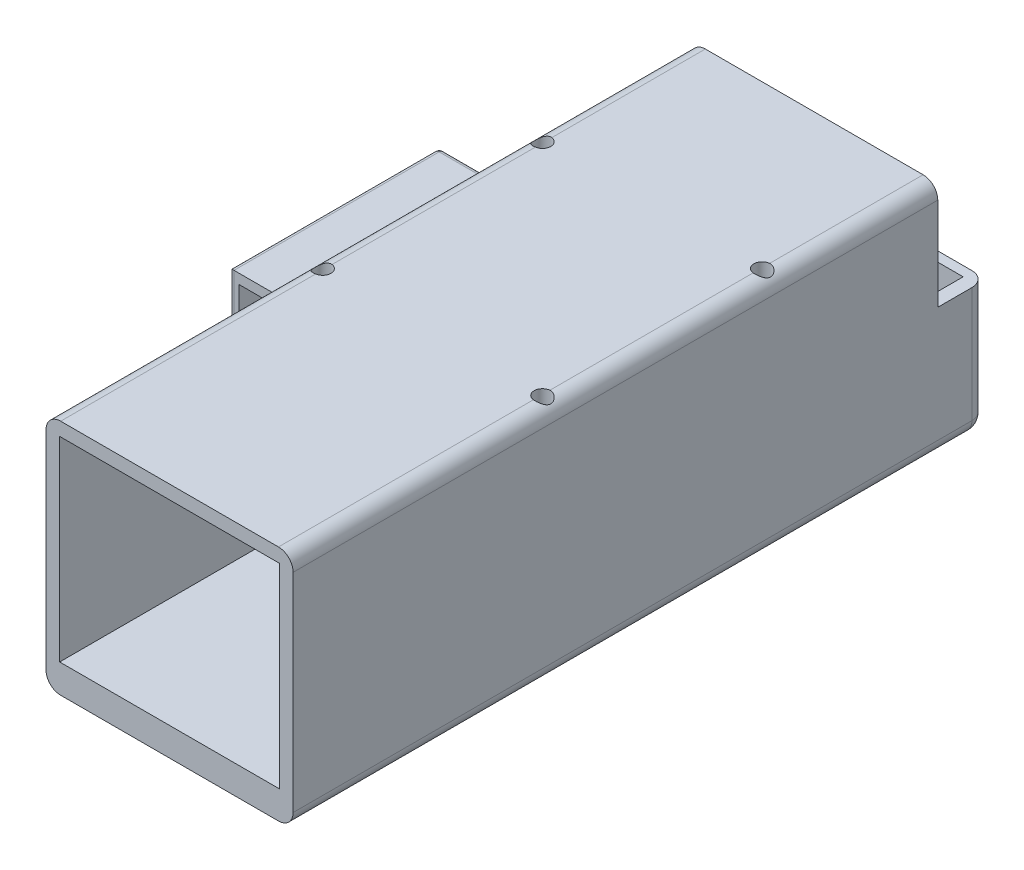
from build123d import *

# Parameters (mm, degrees)
SKETCH1_W           = 50.6
SKETCH1_H           = 45.6
SKETCH1_W_2         = 45
SKETCH1_H_2         = 40
BOSS_EXTRUDE1_DEPTH = 70
SKETCH2_W           = 50.6
SKETCH2_H           = 45.6
BOSS_EXTRUDE2_DEPTH = 2
SKETCH4_R           = 1.7
CUT_EXTRUDE1_DEPTH  = 71.5
SKETCH5_R           = 2.75
CUT_EXTRUDE2_DEPTH  = 12.5
SKETCH6_W           = 50.6
SKETCH6_H           = 4.293520681
BOSS_EXTRUDE3_DEPTH = 142
SKETCH7_R           = 1.7
CUT_EXTRUDE3_DEPTH  = 7.5
FILLET1_R           = 3
CUT_EXTRUDE4_DEPTH  = 22
BOSS_EXTRUDE4_DEPTH = 14.5
SKETCH10_W          = 43
SKETCH10_H          = 28.7
BOSS_EXTRUDE5_DEPTH = 2
SKETCH11_W          = 14
SKETCH11_H          = 24.7
CUT_EXTRUDE5_DEPTH  = 2
SKETCH12_W          = 6
SKETCH12_H          = 6
CUT_EXTRUDE6_DEPTH  = 2
FILLET2_R           = 1


with BuildPart() as part:
    # Sketch1 → Boss-Extrude1 (new, symmetric)
    with BuildSketch(Plane.XY):
        Rectangle(SKETCH1_W, SKETCH1_H)
        Rectangle(SKETCH1_W_2, SKETCH1_H_2, mode=Mode.SUBTRACT)
    extrude(amount=BOSS_EXTRUDE1_DEPTH, both=True)

    # Sketch2 → Boss-Extrude2 (add)
    with BuildSketch(Plane(origin=(0, 0, -70), x_dir=(-1, 0, 0), z_dir=(0, 0, -1))):
        Rectangle(SKETCH2_W, SKETCH2_H)
    extrude(amount=BOSS_EXTRUDE2_DEPTH)

    # Sketch4 → Cut-Extrude1 (cut)
    with BuildSketch(Plane(origin=(0, 22.8, 0), x_dir=(1, 0, 0), z_dir=(0, 1, 0))):
        with Locations(Location((-22.534370918, 28.890457594, 0), (0, 0, 270))):
            Circle(SKETCH4_R)
        with Locations(Location((22.465629082, 28.890457594, 0), (0, 0, 270))):
            Circle(SKETCH4_R)
        with Locations(Location((22.465629082, -16.109542406, 0), (0, 0, 270))):
            Circle(SKETCH4_R)
        with Locations(Location((-22.534370918, -16.109542406, 0), (0, 0, 270))):
            Circle(SKETCH4_R)
    extrude(amount=-CUT_EXTRUDE1_DEPTH, mode=Mode.SUBTRACT)

    # Sketch5 → Cut-Extrude2 (cut)
    with BuildSketch(Plane(origin=(0, -10, 0), x_dir=(1, 0, 0), z_dir=(0, 1, 0))):
        with Locations(Location((22.465629082, 28.890457594, 0), (0, 0, 270))):
            Circle(SKETCH5_R)
        with Locations(Location((22.465629082, -16.109542406, 0), (0, 0, 270))):
            Circle(SKETCH5_R)
        with Locations(Location((-22.534370918, 28.890457594, 0), (0, 0, 270))):
            Circle(SKETCH5_R)
        with Locations(Location((-22.534370918, -16.109542406, 0), (0, 0, 270))):
            Circle(SKETCH5_R)
    extrude(amount=-CUT_EXTRUDE2_DEPTH, mode=Mode.SUBTRACT)

    # Sketch6 → Boss-Extrude3 (add)
    with BuildSketch(Plane.XY.offset(70)):
        with Locations((0, -23.65323966)):
            Rectangle(SKETCH6_W, SKETCH6_H)
    extrude(amount=-BOSS_EXTRUDE3_DEPTH)

    # Sketch7 → Cut-Extrude3 (cut)
    with BuildSketch(Plane(origin=(0, -21.506479319, 0), x_dir=(1, 0, 0), z_dir=(0, 1, 0))):
        with Locations(Location((-22.534370918, 28.890457594, 0), (0, 0, 270))):
            Circle(SKETCH7_R)
        with Locations(Location((22.465629082, 28.890457594, 0), (0, 0, 270))):
            Circle(SKETCH7_R)
        with Locations(Location((22.465629082, -16.109542406, 0), (0, 0, 270))):
            Circle(SKETCH7_R)
        with Locations(Location((-22.534370918, -16.109542406, 0), (0, 0, 270))):
            Circle(SKETCH7_R)
    extrude(amount=-CUT_EXTRUDE3_DEPTH, mode=Mode.SUBTRACT)

    # Fillet1
    # the kernel refuses this fillet: 3 mm, written as the material it takes off along each edge
    with BuildSketch(Plane(origin=(-22.3, -22.8, -69), x_dir=(0, 0, -1), z_dir=(-1, 0, 0))) as fillet1_piece_1_section:
        Polygon((0, 0), (FILLET1_R, 0), (FILLET1_R, FILLET1_R), (0, FILLET1_R), align=None)
    fillet1_piece_1 = extrude(amount=FILLET1_R, mode=Mode.PRIVATE)
    fillet1_piece_1 = fillet1_piece_1 - Plane(origin=(-22.3, -22.8, -69), x_dir=(-2.085182079516792e-15, 0.7071067811865475, 0.7071067811865475), z_dir=(-1, 0, 0)) * Sphere(FILLET1_R, mode=Mode.PRIVATE)
    add(fillet1_piece_1, mode=Mode.SUBTRACT)
    with BuildSketch(Plane(origin=(22.3, -22.8, -69), x_dir=(0, -1, 0), z_dir=(0, 0, -1))) as fillet1_piece_2_section:
        Polygon((0, 0), (FILLET1_R, 0), (FILLET1_R, -FILLET1_R), (0, -FILLET1_R), align=None)
    fillet1_piece_2 = extrude(amount=FILLET1_R, mode=Mode.PRIVATE)
    fillet1_piece_2 = fillet1_piece_2 - Plane(origin=(22.3, -22.8, -69), x_dir=(-0.7071067811865486, 0.7071067811865464, 0), z_dir=(0, 0, -1)) * Sphere(FILLET1_R, mode=Mode.PRIVATE)
    add(fillet1_piece_2, mode=Mode.SUBTRACT)
    with BuildSketch(Plane(origin=(22.3, 19.8, -69), x_dir=(0, 0, -1), z_dir=(0, 1, 0))) as fillet1_piece_3_section:
        Polygon((0, 0), (FILLET1_R, 0), (FILLET1_R, -FILLET1_R), (0, -FILLET1_R), align=None)
    fillet1_piece_3 = extrude(amount=FILLET1_R, mode=Mode.PRIVATE)
    fillet1_piece_3 = fillet1_piece_3 - Plane(origin=(22.3, 19.8, -69), x_dir=(-0.7071067811865475, 0, 0.7071067811865475), z_dir=(0, 1, 0)) * Sphere(FILLET1_R, mode=Mode.PRIVATE)
    add(fillet1_piece_3, mode=Mode.SUBTRACT)
    with BuildSketch(Plane(origin=(-22.3, 19.8, -69), x_dir=(0, 1, 0), z_dir=(-1, 0, 0))) as fillet1_piece_4_section:
        Polygon((0, 0), (FILLET1_R, 0), (FILLET1_R, FILLET1_R), (0, FILLET1_R), align=None)
    fillet1_piece_4 = extrude(amount=FILLET1_R, mode=Mode.PRIVATE)
    fillet1_piece_4 = fillet1_piece_4 - Plane(origin=(-22.3, 19.8, -69), x_dir=(0, -0.7071067811865475, 0.7071067811865475), z_dir=(-1, 0, 0)) * Sphere(FILLET1_R, mode=Mode.PRIVATE)
    add(fillet1_piece_4, mode=Mode.SUBTRACT)
    with BuildSketch(Plane(origin=(-25.3, -25.8, 77.5), x_dir=(0, 1, 0), z_dir=(0, 0, -1)), Plane(origin=(25.3, -25.8, 77.5), x_dir=(-1, 0, 0), z_dir=(0, 0, -1))) as fillet1_piece_5:
        with BuildLine():
            CenterArc((FILLET1_R, FILLET1_R), FILLET1_R, 180, 90)
            Line((0, FILLET1_R), (0, 0))
            Line((0, 0), (FILLET1_R, 0))
        make_face()
    extrude(amount=146.5, mode=Mode.SUBTRACT)
    with BuildSketch(Plane(origin=(-22.3, -25.8, -72), x_dir=(0, 1, 0), z_dir=(1, 0, 0))) as fillet1_piece_6:
        with BuildLine():
            CenterArc((FILLET1_R, FILLET1_R), FILLET1_R, 180, 90)
            Line((0, FILLET1_R), (0, 0))
            Line((0, 0), (FILLET1_R, 0))
        make_face()
    extrude(amount=44.6, mode=Mode.SUBTRACT)
    with BuildSketch(Plane(origin=(25.3, 19.8, -72), x_dir=(-1, 0, 0), z_dir=(0, -1, 0)), Plane(origin=(-25.3, 19.8, -72), x_dir=(0, 0, 1), z_dir=(0, -1, 0))) as fillet1_piece_7:
        with BuildLine():
            CenterArc((FILLET1_R, -FILLET1_R), FILLET1_R, 90, 90)
            Line((0, -FILLET1_R), (0, 0))
            Line((0, 0), (FILLET1_R, 0))
        make_face()
    extrude(amount=42.6, mode=Mode.SUBTRACT)
    with BuildSketch(Plane(origin=(22.3, 22.8, -72), x_dir=(0, 0, 1), z_dir=(-1, 0, 0))) as fillet1_piece_8:
        with BuildLine():
            CenterArc((FILLET1_R, -FILLET1_R), FILLET1_R, 90, 90)
            Line((0, -FILLET1_R), (0, 0))
            Line((0, 0), (FILLET1_R, 0))
        make_face()
    extrude(amount=44.6, mode=Mode.SUBTRACT)
    with BuildSketch(Plane(origin=(25.3, 22.8, 77.5), x_dir=(-1, 0, 0), z_dir=(0, 0, -1)), Plane(origin=(-25.3, 22.8, 77.5), x_dir=(0, -1, 0), z_dir=(0, 0, -1))) as fillet1_piece_9:
        with BuildLine():
            CenterArc((FILLET1_R, -FILLET1_R), FILLET1_R, 90, 90)
            Line((0, -FILLET1_R), (0, 0))
            Line((0, 0), (FILLET1_R, 0))
        make_face()
    extrude(amount=146.5, mode=Mode.SUBTRACT)

    # Sketch8 → Cut-Extrude4 (cut)
    with BuildSketch(Plane.XZ.offset(-22.8)):
        Polygon((-25.3, -62), (25.3, -62), (25.3, -72), (25.3, -74.989483602), (-25.3, -74.989483602), align=None)
    extrude(amount=CUT_EXTRUDE4_DEPTH, mode=Mode.SUBTRACT)

    # Sketch9 → Boss-Extrude4 (add)
    with BuildSketch(Plane.ZY.offset(25.3)):
        Polygon((-25, 11.3), (16, 11.3), (16, 13.3), (-27, 13.3), (-27, -15.4), (16, -15.4), (16, -13.4), (-25, -13.4), align=None)
    extrude(amount=BOSS_EXTRUDE4_DEPTH)

    # Sketch10 → Boss-Extrude5 (add)
    with BuildSketch(Plane.ZY.offset(39.8)):
        with Locations((-5.5, -1.05)):
            Rectangle(SKETCH10_W, SKETCH10_H)
    extrude(amount=BOSS_EXTRUDE5_DEPTH)

    # Sketch11 → Cut-Extrude5 (cut)
    with BuildSketch(Plane.ZY.offset(41.8)):
        with Locations((-3, -1.05)):
            Rectangle(SKETCH11_W, SKETCH11_H)
    extrude(amount=-CUT_EXTRUDE5_DEPTH, mode=Mode.SUBTRACT)

    # Sketch12 → Cut-Extrude6 (cut)
    with BuildSketch(Plane(origin=(0, 0, -27), x_dir=(-1, 0, 0), z_dir=(0, 0, -1))):
        with Locations((33.55, 6.125)):
            Rectangle(SKETCH12_W, SKETCH12_H)
        with Locations((33.55, -8.225)):
            Rectangle(SKETCH12_W, SKETCH12_H)
    extrude(amount=-CUT_EXTRUDE6_DEPTH, mode=Mode.SUBTRACT)

    # Fillet2
    fillet2_edges = [part.edges().sort_by_distance(p)[0] for p in [
        (-33.55, 13.3, -27),
        (-33.55, -15.4, -27),
        (-41.8, -1.05, -27),
        (-41.8, -15.4, -5.5),
        (-41.8, -1.05, 16),
        (-41.8, 13.3, -5.5),
    ]]
    fillet(fillet2_edges, radius=FILLET2_R)


solid = part.part
